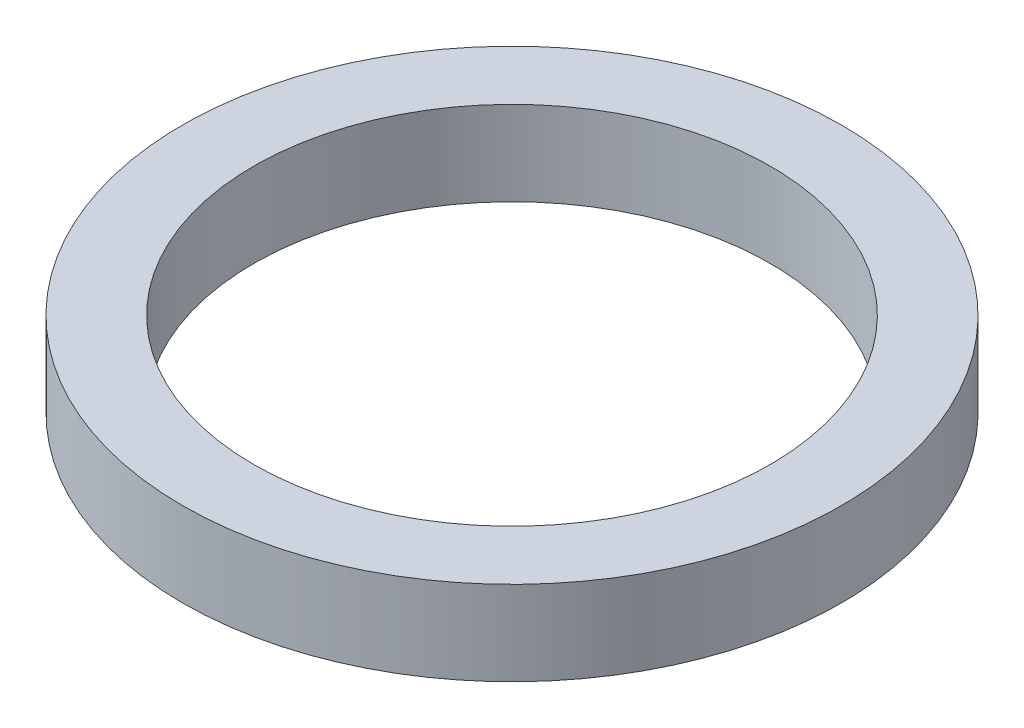
from build123d import *

# Parameters (mm, degrees)
SKETCH1_R           = 21.875
SKETCH1_R_2         = 17.15
BOSS_EXTRUDE1_DEPTH = 5.6


with BuildPart() as part:
    # Sketch1 → Boss-Extrude1 (new body)
    with BuildSketch(Plane(origin=(0, 0, 0), x_dir=(1, 0, 0), z_dir=(0, 1, 0))):
        Circle(SKETCH1_R)
        Circle(SKETCH1_R_2, mode=Mode.SUBTRACT)
    extrude(amount=BOSS_EXTRUDE1_DEPTH)


solid = part.part
